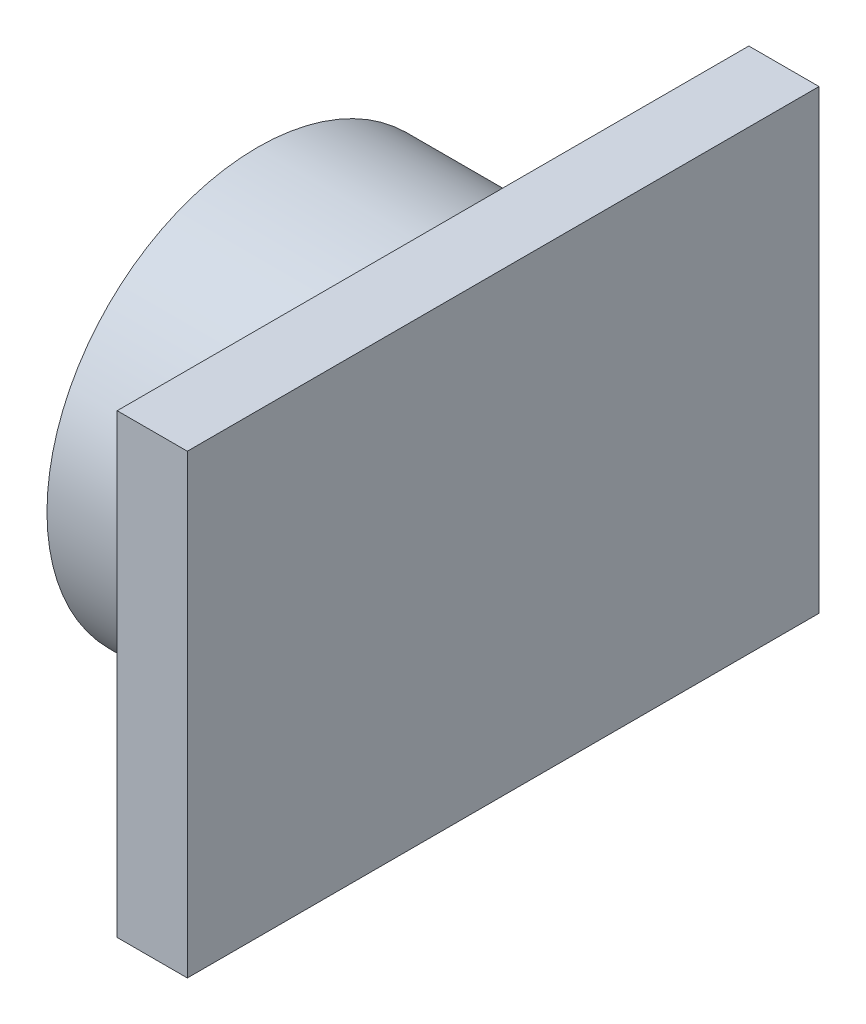
from build123d import *

# Parameters (mm, degrees)
AUFSATZ_LINEAR_START                = -0.4
AUFSATZ_LINEAR_AUSTRAGEN1_OUTLINE_W = 3.6
AUFSATZ_LINEAR_AUSTRAGEN1_OUTLINE_H = 2.6
AUFSATZ_LINEAR_AUSTRAGEN1_DEPTH     = 0.4
SKIZZE2_R                           = 1.2
AUFSATZ_LINEAR_AUSTRAGEN2_DEPTH     = 1


# Read off the part's stored shape, not the designer's step: Aufsatz-Linear austragen1
with BuildPart() as part:
    # Aufsatz-Linear austragen1 outline → Aufsatz-Linear austragen1 (new body)
    with BuildSketch(Plane(origin=(-0.4, 0, 0), x_dir=(0, 0, -1), z_dir=(1, 0, 0)).offset(AUFSATZ_LINEAR_START)):
        with Locations((-18.399365347, -3.04590093)):
            Rectangle(AUFSATZ_LINEAR_AUSTRAGEN1_OUTLINE_W, AUFSATZ_LINEAR_AUSTRAGEN1_OUTLINE_H)
    extrude(amount=AUFSATZ_LINEAR_AUSTRAGEN1_DEPTH)

    # Skizze2 → Aufsatz-Linear austragen2 (add)
    with BuildSketch(Plane(origin=(-0.8, 0, 0), x_dir=(0, 0, -1), z_dir=(1, 0, 0))):
        with Locations((-18.399365347, -3.04590093)):
            Circle(SKIZZE2_R)
    extrude(amount=-AUFSATZ_LINEAR_AUSTRAGEN2_DEPTH)


solid = part.part
